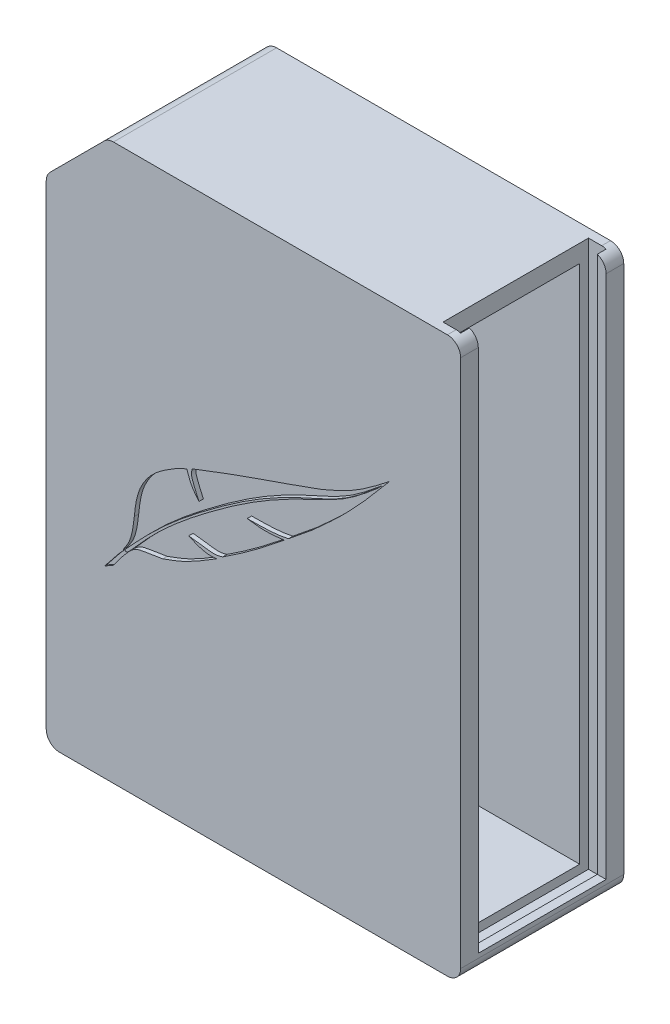
from build123d import *

# Parameters (mm, degrees)
BOSS_EXTRU_1_DEPTH            = 18.5
ESQUISSE5_W                   = 18.5
ESQUISSE5_H                   = 9.899494937
BOSS_EXTRU_3_DEPTH            = 1.5
CONG_1_R                      = 1.5
ENL_V_MAT_EXTRU_7_DEPTH       = 0.5
ENL_V_MAT_EXTRU_9_DEPTH       = 0.2
ENL_V_START                   = -2
ENL_V_MAT_EXTRU_10_DEPTH      = 14.5
ENL_V_MAT_EXTRU_11_DEPTH      = 15.5
ENL_V_MAT_EXTRU_11_DEPTH_BACK = 1
ESQUISSE11_W                  = 2
ESQUISSE11_H                  = 66.45046337
ESQUISSE12_W                  = 2.477505898
ESQUISSE12_H                  = 3.959677151
ENL_V_MAT_EXTRU_12_DEPTH      = 14.5
ENL_V_START_2                 = 3
ESQUISSE13_W                  = 2
ESQUISSE13_H                  = 9
ENL_V_MAT_EXTRU_13_DEPTH      = 2


with BuildPart() as part:
    # Esquisse1 → Boss.-Extru.1 (new body)
    with BuildSketch(Plane.XY):
        Polygon((7, 63), (0, 56), (0, 0), (47, 0), (47, 63), align=None)
    extrude(amount=BOSS_EXTRU_1_DEPTH)

    # Esquisse5 → Boss.-Extru.3 (add)
    with BuildSketch(Plane(origin=(-28, 28, 0), x_dir=(0, 0, 1), z_dir=(-0.707106781186549, 0.7071067811865462, 0))):
        with Locations((9.25, 44.547727215)):
            Rectangle(ESQUISSE5_W, ESQUISSE5_H)
    extrude(amount=-BOSS_EXTRU_3_DEPTH)

    # Congé1
    cong_1_edges = [part.edges().sort_by_distance(p)[0] for p in [
        (0, 0, 9.25),
        (47, 0, 9.25),
        (47, 63, 9.25),
        (0, 56, 9.25),
        (7, 63, 9.25),
    ]]
    fillet(cong_1_edges, radius=CONG_1_R)

    # Esquisse7 → Enlèv. mat.-Extru.7 (cut)
    with BuildSketch(Plane.XY.offset(18.5)):
        with BuildLine():
            add(Edge.make_bspline(
                [(8.741481422, 23.545339958), (8.97426544, 23.884234425), (9.391722632, 24.491982042), (9.801234093, 25.809520444), (9.912339585, 26.761676513), (9.985835627, 27.391525683)],
                knots=[0, 0, 0, 0, 0.299076085, 0.536340353, 1, 1, 1, 1], degree=3))
            add(Edge.make_bspline(
                [(8.800690837, 23.490312703), (8.780021094, 23.50796535), (8.760751258, 23.526652654), (8.741481422, 23.545339958)],
                knots=[0.816445355, 0.816445355, 0.816445355, 0.816445355, 1, 1, 1, 1], degree=3))
            add(Edge.make_bspline(
                [(37.587874359, 43.964061233), (36.322453208, 42.912301808), (33.856892738, 40.863042189), (29.192246001, 38.90002762), (24.068252551, 36.312701669), (18.552137849, 32.455332186), (13.189313268, 28.201783406), (10.124203366, 24.92862823), (8.800690837, 23.490312703)],
                knots=[0, 0, 0, 0, 0.134488449, 0.262038771, 0.413324325, 0.606278792, 0.814215894, 0.974718857, 0.974718857, 0.974718857, 0.974718857], degree=3))
            add(Edge.make_bspline(
                [(9.443588409, 23.726318154), (10.439928849, 24.865322019), (13.17889562, 27.902664607), (18.360152512, 32.08462974), (24.147814444, 36.14388912), (29.439325332, 38.879729859), (34.023974897, 40.940579508), (36.372875034, 42.933300323), (37.587874359, 43.964061233)],
                knots=[0.043476968, 0.043476968, 0.043476968, 0.043476968, 0.167785205, 0.379770977, 0.589080615, 0.748039182, 0.869669971, 1, 1, 1, 1], degree=3))
            add(Edge.make_bspline(
                [(13.209844249, 24.846255718), (12.561216207, 24.741866177), (11.570036096, 24.582346652), (10.21413428, 24.371732671), (9.686497603, 23.950548462), (9.443588409, 23.726318154)],
                knots=[0, 0, 0, 0, 0.449393835, 0.686726756, 0.906490115, 0.906490115, 0.906490115, 0.906490115], degree=3))
            add(Edge.make_bspline(
                [(19.346207327, 27.92037622), (18.649539489, 27.490364128), (17.295751274, 26.654750267), (15.259428846, 25.586185129), (13.871062619, 25.084965025), (13.209844249, 24.846255718)],
                knots=[0, 0, 0, 0, 0.357022344, 0.693777745, 1, 1, 1, 1], degree=3))
            add(Edge.make_bspline(
                [(16.151045098, 28.579318334), (16.706508218, 28.335383374), (17.609553302, 27.93880571), (18.730896282, 27.827227889), (19.225451429, 27.902095693), (19.346207327, 27.92037622)],
                knots=[0, 0, 0, 0, 0.547075637, 0.889409121, 1, 1, 1, 1], degree=3))
            add(Edge.make_bspline(
                [(19.997230823, 28.428298982), (19.766755369, 28.36324029), (19.12544327, 28.182210485), (17.819957633, 28.388483473), (16.776288941, 28.507823681), (16.151045098, 28.579318334)],
                knots=[0, 0, 0, 0, 0.183614026, 0.510917298, 1, 1, 1, 1], degree=3))
            add(Edge.make_bspline(
                [(27.009732384, 33.579925392), (26.292485205, 33.007945409), (24.797708149, 31.815912062), (22.478329122, 30.069627859), (20.822964986, 28.974549539), (19.997230823, 28.428298982)],
                knots=[0, 0, 0, 0, 0.316155138, 0.658882265, 1, 1, 1, 1], degree=3))
            add(Edge.make_bspline(
                [(22.78741232, 33.594631396), (23.47035804, 33.500852352), (24.67880724, 33.334913527), (26.092254902, 33.472354396), (26.813238587, 33.556887188), (27.009732384, 33.579925392)],
                knots=[0, 0, 0, 0, 0.485970736, 0.859908672, 1, 1, 1, 1], degree=3))
            add(Edge.make_bspline(
                [(27.476930827, 33.958322193), (27.261994438, 33.912287048), (26.51014109, 33.751254856), (24.939704804, 33.622032753), (23.589244994, 33.604839722), (22.78741232, 33.594631396)],
                knots=[0, 0, 0, 0, 0.139880518, 0.489305866, 1, 1, 1, 1], degree=3))
            add(Edge.make_bspline(
                [(30.178310683, 36.158566674), (29.975674371, 35.998229226), (29.462468598, 35.592151447), (28.569556831, 34.84941734), (27.869795727, 34.278724604), (27.476930827, 33.958322193)],
                knots=[0, 0, 0, 0, 0.222488299, 0.563483801, 1, 1, 1, 1], degree=3))
            add(Edge.make_bspline(
                [(38.945351674, 45.321538548), (38.420171007, 44.695713388), (36.761155938, 42.718768237), (33.941660103, 39.55384301), (31.404658543, 37.264972007), (30.178310683, 36.158566674)],
                knots=[0, 0, 0, 0, 0.193087, 0.609950563, 1, 1, 1, 1], degree=3))
            add(Edge.make_bspline(
                [(31.252980224, 40.683491056), (32.324827658, 41.14326203), (34.307774375, 41.993850755), (36.826194398, 43.657503938), (38.274775575, 44.794979312), (38.945351674, 45.321538548)],
                knots=[0, 0, 0, 0, 0.387194684, 0.716320628, 1, 1, 1, 1], degree=3))
            add(Edge.make_bspline(
                [(16.565641294, 35.366704907), (18.224543129, 36.00479534), (21.682233863, 37.334783247), (26.615085728, 39.004604912), (29.840038582, 40.172015828), (31.252980224, 40.683491056)],
                knots=[0, 0, 0, 0, 0.341315206, 0.711411851, 1, 1, 1, 1], degree=3))
            add(Edge.make_bspline(
                [(17.320172435, 32.538627168), (17.095643767, 33.034221194), (16.740497225, 33.818123337), (16.398777614, 34.815395743), (16.52931247, 35.246676309), (16.565641294, 35.366704907)],
                knots=[0, 0, 0, 0, 0.553685075, 0.875787227, 1, 1, 1, 1], degree=3))
            add(Edge.make_bspline(
                [(15.932717497, 35.050525816), (15.968390486, 34.968733309), (16.124488937, 34.610824317), (16.392954493, 33.675509429), (16.95320176, 32.988577964), (17.320172435, 32.538627168)],
                knots=[0, 0, 0, 0, 0.092717793, 0.405716039, 1, 1, 1, 1], degree=3))
            add(Edge.make_bspline(
                [(14.793567783, 34.518281585), (14.908073567, 34.57528331), (15.147913789, 34.694677334), (15.52805859, 34.871411668), (15.794398468, 34.989301673), (15.932717497, 35.050525816)],
                knots=[0, 0, 0, 0, 0.305139846, 0.639136348, 1, 1, 1, 1], degree=3))
            add(Edge.make_bspline(
                [(9.985835627, 27.391525683), (10.083402404, 28.278864149), (10.285137329, 30.113578429), (11.930749087, 32.794310056), (13.772036135, 33.90312161), (14.793567783, 34.518281585)],
                knots=[0, 0, 0, 0, 0.294280708, 0.608472459, 1, 1, 1, 1], degree=3))
        make_face()
    extrude(amount=-ENL_V_MAT_EXTRU_7_DEPTH, mode=Mode.SUBTRACT)

    # Esquisse8 → Enlèv. mat.-Extru.9 (cut)
    with BuildSketch(Plane.XY.offset(18.5)):
        with BuildLine():
            add(Edge.make_bspline(
                [(9.219208695, 23.519291104), (9.176868463, 23.503048303), (9.073549799, 23.463412607), (8.952624188, 23.520506831), (8.89240353, 23.568918106), (8.882487226, 23.577386959)],
                knots=[0, 0, 0, 0, 0.298493917, 0.728385063, 0.816445355, 0.816445355, 0.816445355, 0.816445355], degree=3))
            add(Edge.make_bspline(
                [(8.882487226, 23.577386959), (8.674018118, 23.350835), (8.465840191, 23.123974501), (8.257662264, 22.897114002)],
                knots=[0.974718857, 0.974718857, 0.974718857, 0.974718857, 1, 1, 1, 1], degree=3))
            add(Edge.make_bspline(
                [(8.257662264, 22.897114002), (8.120380319, 22.724431783), (7.726303318, 22.228735927), (7.172014223, 21.551305412), (6.767070551, 21.036911066), (6.617377175, 20.846757641)],
                knots=[0, 0, 0, 0, 0.25204317, 0.723506773, 1, 1, 1, 1], degree=3))
            add(Edge.make_bspline(
                [(6.617377175, 20.846757641), (6.67105197, 20.876575617), (6.846524977, 20.974056193), (7.146714282, 21.163568152), (7.411642244, 21.289656477), (7.550642829, 21.355811634)],
                knots=[0, 0, 0, 0, 0.173191566, 0.566195825, 1, 1, 1, 1], degree=3))
            add(Edge.make_bspline(
                [(7.550642829, 21.355811634), (7.594875595, 21.408819409), (7.758493986, 21.604896833), (8.073049619, 22.022428419), (8.331605023, 22.394899892), (8.483908483, 22.614306228)],
                knots=[0, 0, 0, 0, 0.132137543, 0.488780926, 1, 1, 1, 1], degree=3))
            add(Edge.make_bspline(
                [(8.483908483, 22.614306228), (8.830410957, 23.014665275), (9.176913431, 23.415024323), (9.525384799, 23.813392409)],
                knots=[0, 0, 0, 0, 0.043476968, 0.043476968, 0.043476968, 0.043476968], degree=3))
            add(Edge.make_bspline(
                [(9.525384799, 23.813392409), (9.422026301, 23.717981826), (9.320617498, 23.618636465), (9.219208695, 23.519291104)],
                knots=[0.906490115, 0.906490115, 0.906490115, 0.906490115, 1, 1, 1, 1], degree=3))
        make_face()
    extrude(amount=-ENL_V_MAT_EXTRU_9_DEPTH, mode=Mode.SUBTRACT)

    # Esquisse10 → Enlèv. mat.-Extru.10 (cut)
    with BuildSketch(Plane(origin=(0, 0, 0), x_dir=(-1, 0, 0), z_dir=(0, 0, -1)).offset(ENL_V_START)):
        Polygon((-47.600891072, 61), (-7.828427125, 61), (-2, 55.171572875), (-2, 2), (-47.600891072, 2), align=None)
    extrude(amount=-ENL_V_MAT_EXTRU_10_DEPTH, mode=Mode.SUBTRACT)

    # Esquisse11 → Enlèv. mat.-Extru.11 (cut, two sides: drawn at the far end of the back side and taken through both)
    with BuildSketch(Plane.XY.offset(2).offset(-ENL_V_MAT_EXTRU_11_DEPTH_BACK)):
        with Locations((45, 34.225231685)):
            Rectangle(ESQUISSE11_W, ESQUISSE11_H)
    extrude(amount=ENL_V_MAT_EXTRU_11_DEPTH + ENL_V_MAT_EXTRU_11_DEPTH_BACK, mode=Mode.SUBTRACT)

    # Esquisse12 → Enlèv. mat.-Extru.12 (cut)
    with BuildSketch(Plane.XY.offset(2)):
        with Locations((47.238752949, 61.767431922)):
            Rectangle(ESQUISSE12_W, ESQUISSE12_H)
    extrude(amount=ENL_V_MAT_EXTRU_12_DEPTH, mode=Mode.SUBTRACT)

    # Esquisse13 → Enlèv. mat.-Extru.13 (cut)
    with BuildSketch(Plane.XY.offset(2).offset(ENL_V_START_2)):
        with Locations((1, 41.3)):
            Rectangle(ESQUISSE13_W, ESQUISSE13_H)
    extrude(amount=ENL_V_MAT_EXTRU_13_DEPTH, mode=Mode.SUBTRACT)


solid = part.part
